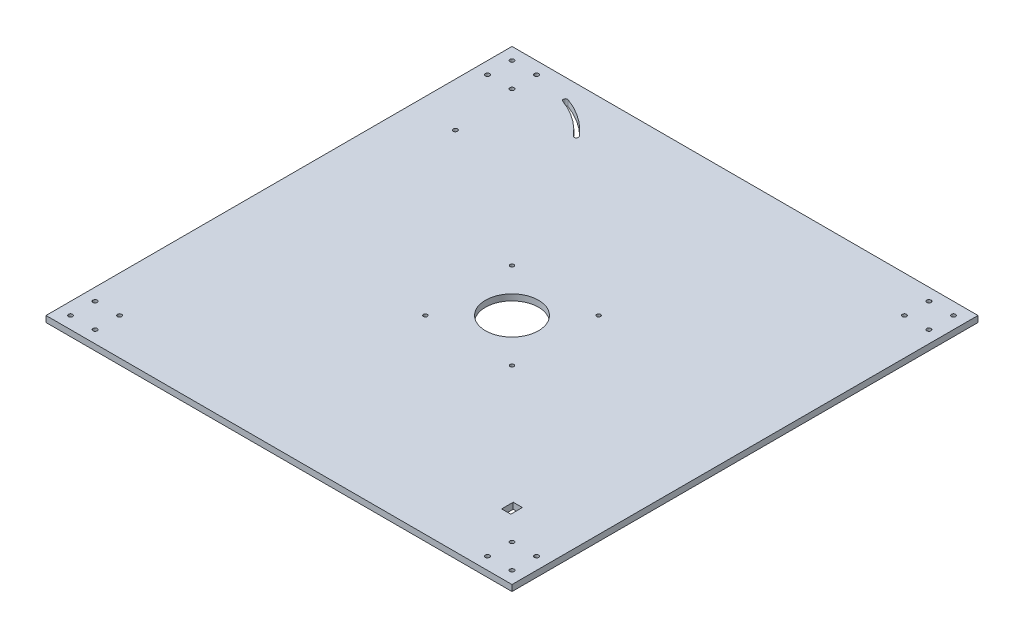
from build123d import *

# Parameters (mm, degrees)
SKETCH1_W               = 482.6
SKETCH1_H               = 482.6
BOSS_EXTRUDE1_DEPTH     = 6.35
CUT_EXTRUDE1_DEPTH      = 342.30880812
CUT_EXTRUDE1_DEPTH_BACK = 342.30880812
SKETCH2_R               = 1.984375
SKETCH2_R_2             = 27.432
SKETCH3_W               = 9.5
SKETCH3_H               = 12
CUT_EXTRUDE2_DEPTH      = 342.30880812
SKETCH4_R               = 2.1828125
CUT_EXTRUDE3_DEPTH      = 342.30880812
SKETCH5_R               = 2.1828125
CUT_EXTRUDE4_DEPTH      = 342.30880812


with BuildPart() as part:
    # Sketch1 → Boss-Extrude1 (new body)
    with BuildSketch(Plane(origin=(0, 0, 0), x_dir=(1, 0, 0), z_dir=(0, 1, 0))):
        Rectangle(SKETCH1_W, SKETCH1_H)
    extrude(amount=BOSS_EXTRUDE1_DEPTH)

    # Sketch2 → Cut-Extrude1 (cut, two sides: drawn at the far end of the back side and taken through both)
    with BuildSketch(Plane(origin=(0, 6.35, 0), x_dir=(1, 0, 0), z_dir=(0, 1, 0)).offset(-CUT_EXTRUDE1_DEPTH_BACK)):
        with Locations((-44.8437, 44.8437)):
            Circle(SKETCH2_R)
        with Locations((44.8437, 44.8437)):
            Circle(SKETCH2_R)
        with Locations((-44.8437, -44.8437)):
            Circle(SKETCH2_R)
        with Locations((44.8437, -44.8437)):
            Circle(SKETCH2_R)
        Circle(SKETCH2_R_2)
    extrude(amount=CUT_EXTRUDE1_DEPTH + CUT_EXTRUDE1_DEPTH_BACK, mode=Mode.SUBTRACT)

    # Sketch3 → Cut-Extrude2 (cut, through all)
    with BuildSketch(Plane(origin=(0, 6.35, 0), x_dir=(1, 0, 0), z_dir=(0, 1, 0))):
        with Locations((172.869930331, -172.869930331)):
            Rectangle(SKETCH3_W, SKETCH3_H)
    extrude(amount=-CUT_EXTRUDE2_DEPTH, mode=Mode.SUBTRACT)

    # Sketch4 → Cut-Extrude3 (cut, through all)
    with BuildSketch(Plane(origin=(0, 6.35, 0), x_dir=(1, 0, 0), z_dir=(0, 1, 0))):
        with Locations((-228.6, 228.6)):
            Circle(SKETCH4_R)
        with Locations((-203.2, 228.6)):
            Circle(SKETCH4_R)
        with Locations((-228.6, 203.2)):
            Circle(SKETCH4_R)
        with Locations((-203.2, 203.2)):
            Circle(SKETCH4_R)
        with Locations((203.2, 228.6)):
            Circle(SKETCH4_R)
        with Locations((203.2, 203.2)):
            Circle(SKETCH4_R)
        with Locations((228.6, 203.2)):
            Circle(SKETCH4_R)
        with Locations((228.6, 228.6)):
            Circle(SKETCH4_R)
        with Locations((203.2, -203.2)):
            Circle(SKETCH4_R)
        with Locations((228.6, -203.2)):
            Circle(SKETCH4_R)
        with Locations((228.6, -228.6)):
            Circle(SKETCH4_R)
        with Locations((203.2, -228.6)):
            Circle(SKETCH4_R)
        with Locations((-228.6, -203.2)):
            Circle(SKETCH4_R)
        with Locations((-203.2, -203.2)):
            Circle(SKETCH4_R)
        with Locations((-203.2, -228.6)):
            Circle(SKETCH4_R)
        with Locations((-228.6, -228.6)):
            Circle(SKETCH4_R)
    extrude(amount=-CUT_EXTRUDE3_DEPTH, mode=Mode.SUBTRACT)

    # Sketch5 → Cut-Extrude4 (cut, through all)
    with BuildSketch(Plane(origin=(0, 6.35, 0), x_dir=(1, 0, 0), z_dir=(0, 1, 0))):
        with Locations((-195.580742094, 136.947109943)):
            Circle(SKETCH5_R)
        with BuildLine():
            ThreePointArc((-125.807259715, 195.494013274), (-143.337787088, 211.557782002), (-164.428585509, 222.53695673))
            ThreePointArc((-164.428585509, 222.53695673), (-167.226324152, 221.232349775), (-165.921717197, 218.434611132))
            ThreePointArc((-165.921717197, 218.434611132), (-145.841806718, 207.981671359), (-129.151522487, 192.687843615))
            ThreePointArc((-129.151522487, 192.687843615), (-126.076306272, 192.418797058), (-125.807259715, 195.494013274))
        make_face()
    extrude(amount=-CUT_EXTRUDE4_DEPTH, mode=Mode.SUBTRACT)


solid = part.part
